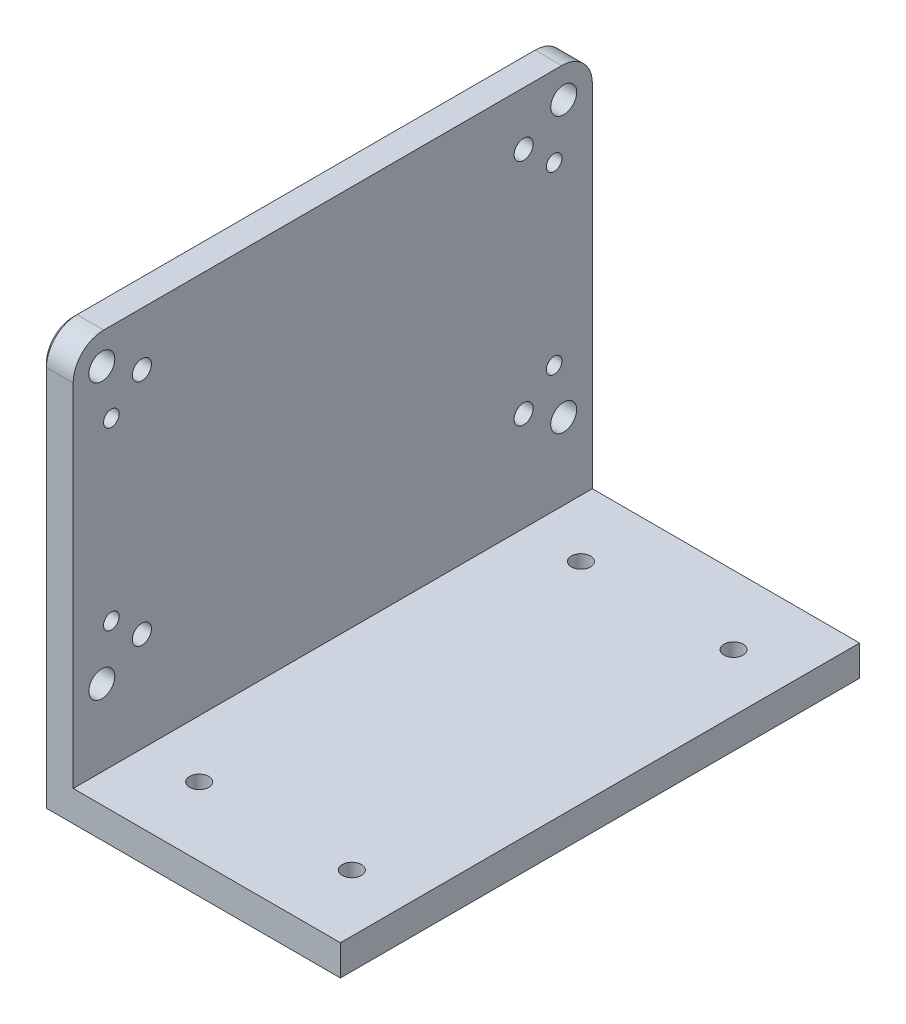
from build123d import *

# Parameters (mm, degrees)
BOSS_EXTRUDE1_DEPTH          = 68
M3_CLEARANCE_HOLE1_D         = 3.4
M3_CLEARANCE_HOLE1_DEPTH     = 5
M3_CLEARANCE_HOLE1_TIP       = 1.021463052
M3X0_5_TAPPED_HOLE1_D        = 2.5
M3X0_5_TAPPED_HOLE1_DEPTH    = 8
M3X0_5_TAPPED_HOLE1_TIP      = 0.751075774
FILLET1_R                    = 4
CHAMFER1_SIZE                = 0.5
M2_5X0_45_TAPPED_HOLE1_D     = 2.05
M2_5X0_45_TAPPED_HOLE1_DEPTH = 7.25
M2_5X0_45_TAPPED_HOLE1_TIP   = 0.615882135
M3X0_5_TAPPED_HOLE3_D        = 2.5
M3X0_5_TAPPED_HOLE3_DEPTH    = 8.5
M3X0_5_TAPPED_HOLE3_TIP      = 0.751075774


with BuildPart() as part:
    # Sketch1 → Boss-Extrude1 (new body)
    with BuildSketch(Plane.XY):
        Polygon((0, 0), (39, 0), (39, 4), (4, 4), (4, 54), (0, 54), align=None)
    extrude(amount=BOSS_EXTRUDE1_DEPTH)

    # M3 Clearance Hole1
    with Locations(Plane(origin=(4, 0, 0), x_dir=(0, 0, -1), z_dir=(1, 0, 0))):
        with Locations((-64.25, 50), (-3.75, 50), (-3.75, 14), (-64.25, 14)):
            Hole(M3_CLEARANCE_HOLE1_D / 2, depth=M3_CLEARANCE_HOLE1_DEPTH)
            with Locations((0, 0, -(M3_CLEARANCE_HOLE1_DEPTH + M3_CLEARANCE_HOLE1_TIP / 2))):  # 118° drill point
                Cone(0, M3_CLEARANCE_HOLE1_D / 2, M3_CLEARANCE_HOLE1_TIP, mode=Mode.SUBTRACT)

    # M3x0.5 Tapped Hole1
    with Locations(Plane(origin=(0, 4, 0), x_dir=(1, 0, 0), z_dir=(0, 1, 0))):
        with Locations((31.5, -59), (11.5, -59), (11.5, -9), (31.5, -9)):
            Hole(M3X0_5_TAPPED_HOLE1_D / 2, depth=M3X0_5_TAPPED_HOLE1_DEPTH)
            with Locations((0, 0, -(M3X0_5_TAPPED_HOLE1_DEPTH + M3X0_5_TAPPED_HOLE1_TIP / 2))):  # 118° drill point
                Cone(0, M3X0_5_TAPPED_HOLE1_D / 2, M3X0_5_TAPPED_HOLE1_TIP, mode=Mode.SUBTRACT)

    # Fillet1
    fillet1_edges = [part.edges().sort_by_distance(p)[0] for p in [
        (2, 54, 68),
        (2, 54, 0),
    ]]
    fillet(fillet1_edges, radius=FILLET1_R)

    # Chamfer1
    chamfer1_edges = [part.edges().sort_by_distance(p)[0] for p in [
        (0, 25, 68),
        (0, 52.828427125, 66.828427125),
        (0, 54, 34),
        (0, 52.828427125, 1.171572875),
        (0, 25, 0),
    ]]
    chamfer(chamfer1_edges, length=CHAMFER1_SIZE)

    # M2.5x0.45 Tapped Hole1
    with Locations(Plane.ZY):
        with Locations((5, 43.5), (63, 43.5), (63, 20.5), (5, 20.5)):
            Hole(M2_5X0_45_TAPPED_HOLE1_D / 2, depth=M2_5X0_45_TAPPED_HOLE1_DEPTH)
            with Locations((0, 0, -(M2_5X0_45_TAPPED_HOLE1_DEPTH + M2_5X0_45_TAPPED_HOLE1_TIP / 2))):  # 118° drill point
                Cone(0, M2_5X0_45_TAPPED_HOLE1_D / 2, M2_5X0_45_TAPPED_HOLE1_TIP, mode=Mode.SUBTRACT)

    # M3x0.5 Tapped Hole3
    with Locations(Plane.ZY):
        with Locations((9, 17), (9, 47), (59, 47), (59, 17)):
            Hole(M3X0_5_TAPPED_HOLE3_D / 2, depth=M3X0_5_TAPPED_HOLE3_DEPTH)
            with Locations((0, 0, -(M3X0_5_TAPPED_HOLE3_DEPTH + M3X0_5_TAPPED_HOLE3_TIP / 2))):  # 118° drill point
                Cone(0, M3X0_5_TAPPED_HOLE3_D / 2, M3X0_5_TAPPED_HOLE3_TIP, mode=Mode.SUBTRACT)


solid = part.part
